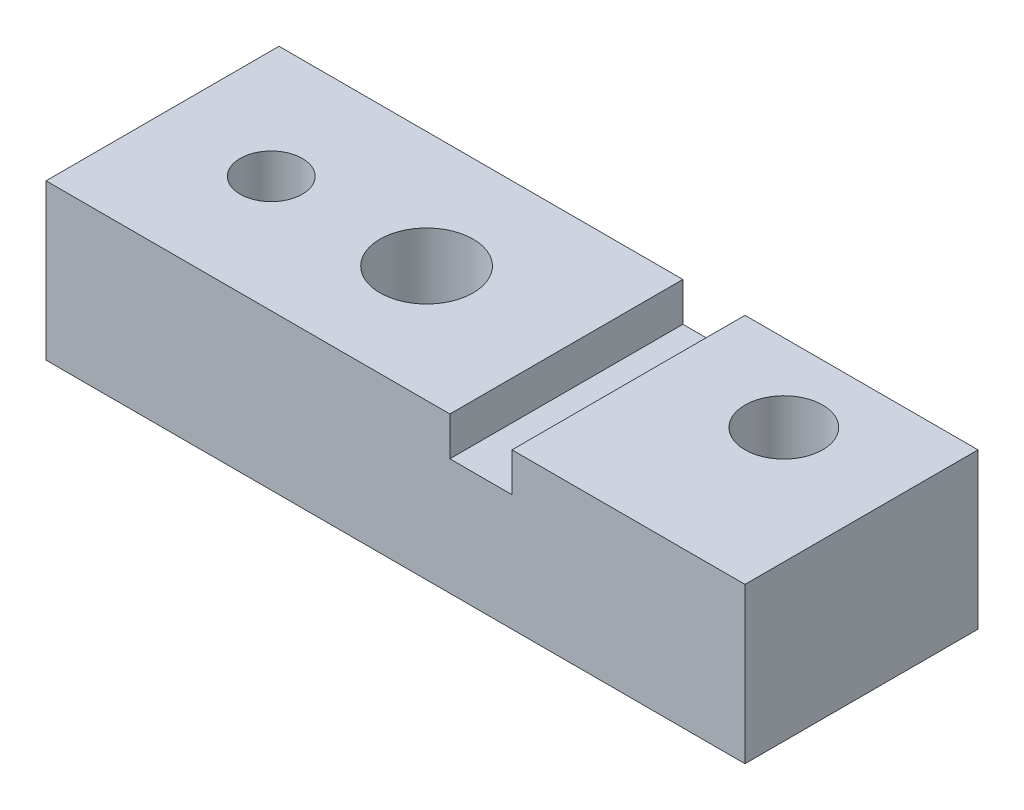
from build123d import *

# Parameters (mm, degrees)
SKETCH_1_W          = 90
SKETCH_1_H          = 30
EXTRUDE_1_DEPTH     = 20
SKETCH_2_W          = 8
SKETCH_2_H          = 30
CUT_EXTRUDE_1_DEPTH = 5
SKETCH_8_R          = 5
CUT_EXTRUDE_2_DEPTH = 97.953597148


with BuildPart() as part:
    # Эскиз1 → Бобышка-Вытянуть1 (new body)
    with BuildSketch(Plane(origin=(0, 0, 0), x_dir=(1, 0, 0), z_dir=(0, 1, 0))):
        with Locations((45, 15)):
            Rectangle(SKETCH_1_W, SKETCH_1_H)
    extrude(amount=-EXTRUDE_1_DEPTH)

    # Эскиз2 → Вырез-Вытянуть1 (cut)
    with BuildSketch(Plane(origin=(0, 0, 0), x_dir=(1, 0, 0), z_dir=(0, 1, 0))):
        with Locations((56, 15)):
            Rectangle(SKETCH_2_W, SKETCH_2_H)
    extrude(amount=-CUT_EXTRUDE_1_DEPTH, mode=Mode.SUBTRACT)

    # Эскиз5 → Вырез-Повернуть1 (revolve, cut)
    with BuildSketch(Plane.XY.offset(-15)):
        Polygon((34, 0), (28, 0), (28, -12), (31, -12), (31, -20), (34, -20), align=None)
    revolve(axis=Axis((34, -20, -15), (0, 1, 0)), mode=Mode.SUBTRACT)

    # Эскиз7 → Вырез-Повернуть2 (revolve, cut)
    with BuildSketch(Plane.XY.offset(-15)):
        Polygon((14, 0), (10, 0), (10, -10), (14, -12.309401077), align=None)
    revolve(axis=Axis((14, 0, -15), (0, -1, 0)), mode=Mode.SUBTRACT)

    # Эскиз8 → Вырез-Вытянуть2 (cut, through all)
    with BuildSketch(Plane(origin=(0, 0, 0), x_dir=(1, 0, 0), z_dir=(0, 1, 0))):
        with Locations((75, 20)):
            Circle(SKETCH_8_R)
    extrude(amount=-CUT_EXTRUDE_2_DEPTH, mode=Mode.SUBTRACT)


solid = part.part
